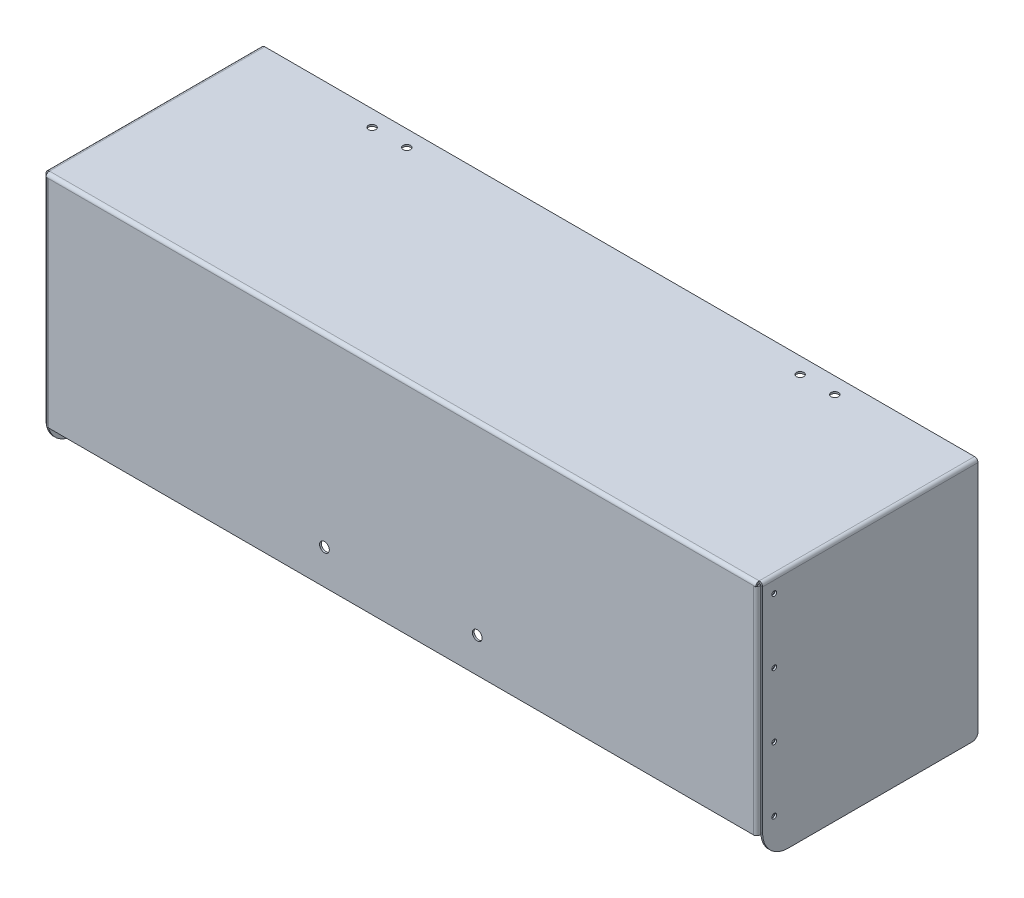
from build123d import *

# Parameters (mm, degrees)
BASE_FLANGE1_DEPTH             = 186
EDGE_FLANGE1_DEPTH             = 613
M6_CLEARANCE_HOLE1_D           = 6.4
EDGE_FLANGE2_STRIP_W           = 10
EDGE_FLANGE2_STRIP_H           = 1.5
EDGE_FLANGE2_STRIP_CUT_DEPTH   = 186.5
EDGE_FLANGE2_STRIP_2_W         = 10
EDGE_FLANGE2_STRIP_2_H         = 1.5
EDGE_FLANGE2_STRIP_CUT_2_DEPTH = 186.5
EDGE_FLANGE2_DEPTH             = 186.5
EDGE_FLANGE2_BEND_DEPTH        = 186.5
SKETCH17_R                     = 2.05
CUT_EXTRUDE1_DEPTH             = 681.27365817
LPATTERN1_COUNT                = 4
LPATTERN1_PITCH                = 55.5
FILLET1_R                      = 22
FILLET2_R                      = 5
M8_CLEARANCE_HOLE1_D           = 8.4


# Sheet-metal steps are written as plain solids
with BuildPart() as part:
    # Sketch1 → Base-Flange1 (new body)
    with BuildSketch(Plane.XY):
        with BuildLine():
            Line((-308, 0), (-308, 206.5))
            ThreePointArc((-308, 206.5), (-307.560660172, 207.560660172), (-306.5, 208))
            Line((-306.5, 208), (306.5, 208))
            ThreePointArc((306.5, 208), (307.560660172, 207.560660172), (308, 206.5))
            Line((308, 206.5), (308, 0))
            Line((308, 0), (309.5, 0))
            Line((309.5, 0), (309.5, 206.5))
            ThreePointArc((309.5, 206.5), (308.621320344, 208.621320344), (306.5, 209.5))
            Line((306.5, 209.5), (-306.5, 209.5))
            ThreePointArc((-306.5, 209.5), (-308.621320344, 208.621320344), (-309.5, 206.5))
            Line((-309.5, 206.5), (-309.5, 0))
            Line((-309.5, 0), (-308, 0))
        make_face()
    extrude(amount=BASE_FLANGE1_DEPTH)

    # Edge-Flange1 section (across the edge) → Edge-Flange1 (add)
    with BuildSketch(Plane(origin=(306.5, 208, 187.5), x_dir=(0, 0, -1), z_dir=(-1, 0, 0))):
        with BuildLine():
            Line((-1.5, 1.5), (-1.5, 188))
            Line((-1.5, 188), (0, 188))
            Line((0, 188), (0, 1.5))
            ThreePointArc((0, 1.5), (0.439339828, 0.439339828), (1.5, 0))
            Line((1.5, 0), (1.5, -1.5))
            ThreePointArc((1.5, -1.5), (-0.621320344, -0.621320344), (-1.5, 1.5))
        make_face()
    extrude(amount=EDGE_FLANGE1_DEPTH)

    # M6 Clearance Hole1 (through all)
    with Locations(Plane(origin=(0, 209.5, 0), x_dir=(1, 0, 0), z_dir=(0, 1, 0))):
        with Locations((-199.845948124, -14), (-169.845948124, -14)):
            m6_clearance_hole1 = Hole(M6_CLEARANCE_HOLE1_D / 2)

    # Mirror1: M6 Clearance Hole1 across plane
    add(m6_clearance_hole1.mirror(Plane(origin=(0, 0, 0), x_dir=(0, 0, 1), z_dir=(1, 0, 0))), mode=Mode.SUBTRACT)

    # Edge-Flange2 strip (across the edge) → Edge-Flange2 strip cut (cut)
    with BuildSketch(Plane(origin=(-307.5, 20, 187.5), x_dir=(1, 0, 0), z_dir=(0, 1, 0))):
        with Locations((-2, -0.75)):
            Rectangle(EDGE_FLANGE2_STRIP_W, EDGE_FLANGE2_STRIP_H)
    extrude(amount=EDGE_FLANGE2_STRIP_CUT_DEPTH, mode=Mode.SUBTRACT)

    # Edge-Flange2 strip 2 (across the edge) → Edge-Flange2 strip cut 2 (cut)
    with BuildSketch(Plane(origin=(307.5, 206.5, 187.5), x_dir=(-1, 0, 0), z_dir=(0, -1, 0))):
        with Locations((-2, -0.75)):
            Rectangle(EDGE_FLANGE2_STRIP_2_W, EDGE_FLANGE2_STRIP_2_H)
    extrude(amount=EDGE_FLANGE2_STRIP_CUT_2_DEPTH, mode=Mode.SUBTRACT)

    # Edge-Flange2 section (across the edge) → Edge-Flange2 (add)
    with BuildSketch(Plane(origin=(-307.5, 20, 187.5), x_dir=(1, 0, 0), z_dir=(0, 1, 0))):
        with BuildLine():
            Line((0, 1.5), (0, 18.5))
            Line((0, 18.5), (1.5, 18.5))
            Line((1.5, 18.5), (1.5, 1.5))
            ThreePointArc((1.5, 1.5), (1.939339828, 0.439339828), (3, 0))
            Line((3, 0), (3, -1.5))
            ThreePointArc((3, -1.5), (0.878679656, -0.621320344), (0, 1.5))
        make_face()
    extrude(amount=EDGE_FLANGE2_DEPTH)

    # Edge-Flange2 section 2 (across the edge) → Edge-Flange2 bend (add)
    with BuildSketch(Plane(origin=(307.5, 206.5, 187.5), x_dir=(-1, 0, 0), z_dir=(0, -1, 0))):
        with BuildLine():
            Line((0, 1.5), (0, 18.5))
            Line((0, 18.5), (1.5, 18.5))
            Line((1.5, 18.5), (1.5, 1.5))
            ThreePointArc((1.5, 1.5), (1.939339828, 0.439339828), (3, 0))
            Line((3, 0), (3, -1.5))
            ThreePointArc((3, -1.5), (0.878679656, -0.621320344), (0, 1.5))
        make_face()
    extrude(amount=EDGE_FLANGE2_BEND_DEPTH)

    # Sketch17 → Cut-Extrude1 (cut, through all)
    with BuildSketch(Plane.ZY.offset(309.5)):
        with Locations((176, 196.5)):
            Circle(SKETCH17_R)
    cut_extrude1 = extrude(amount=-CUT_EXTRUDE1_DEPTH, mode=Mode.SUBTRACT)

    # LPattern1: Cut-Extrude1 ×4
    with Locations(*[(0, -i * LPATTERN1_PITCH, 0) for i in range(1, LPATTERN1_COUNT)]):
        add(cut_extrude1, mode=Mode.SUBTRACT)

    # Fillet1
    fillet1_edges = [part.edges().sort_by_distance(p)[0] for p in [
        (-308.75, 0, 186),
        (308.75, 0, 186),
    ]]
    fillet(fillet1_edges, radius=FILLET1_R)

    # Fillet2
    fillet2_edges = [part.edges().sort_by_distance(p)[0] for p in [
        (-308.75, 0, 0),
        (-306.75, 20, 169),
        (-306.75, 206.5, 169),
        (308.75, 0, 0),
        (306.75, 206.5, 169),
        (306.75, 20, 169),
    ]]
    fillet(fillet2_edges, radius=FILLET2_R)

    # M8 Clearance Hole1 (through all)
    with Locations(Plane.XY.offset(189)):
        with Locations((-66, 50), (66, 50)):
            Hole(M8_CLEARANCE_HOLE1_D / 2)


solid = part.part
